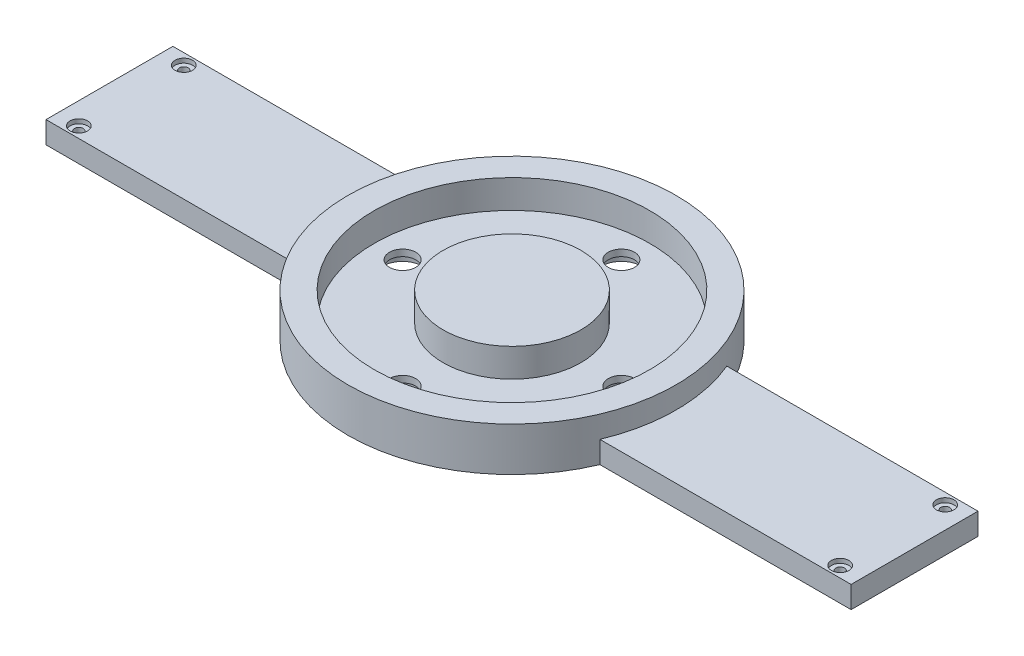
from build123d import *

# Parameters (mm, degrees)
SKETCH1_R             = 37.5
BOSS_EXTRUDE1_DEPTH   = 10
SKETCH2_R             = 31.5
CUT_EXTRUDE1_DEPTH    = 6.5
SKETCH4_R             = 15.75
BOSS_EXTRUDE2_DEPTH   = 6.5
SKETCH5_R             = 3
CUT_EXTRUDE2_DEPTH    = 3.5
CIRPATTERN3_OUTLINE_R = 3
CIRPATTERN3_DEPTH     = 3.5
BOSS_EXTRUDE3_DEPTH   = 5
CIRPATTERN4_COUNT     = 4
SKETCH9_R             = 4.5
CUT_EXTRUDE3_DEPTH    = 2
CIRPATTERN5_COUNT     = 4
SKETCH10_R            = 1
CUT_EXTRUDE4_DEPTH    = 5
LPATTERN1_COUNT       = 2
LPATTERN1_PITCH       = 174
LPATTERN1_COUNT_DIR2  = 2
LPATTERN1_PITCH_DIR2  = 24
SKETCH11_R            = 2
CUT_EXTRUDE5_DEPTH    = 1
LPATTERN2_COUNT       = 2
LPATTERN2_PITCH       = 174
LPATTERN2_COUNT_DIR2  = 2
LPATTERN2_PITCH_DIR2  = 24


# Read off the part's stored shape, not the designer's step: CirPattern3
with BuildPart() as part:
    # Sketch1 → Boss-Extrude1 (new body)
    with BuildSketch(Plane(origin=(0, 0, 0), x_dir=(1, 0, 0), z_dir=(0, 1, 0))):
        with Locations(Location((0, 0, 0), (0, 0, 270))):
            Circle(SKETCH1_R)
    extrude(amount=BOSS_EXTRUDE1_DEPTH)

    # Sketch2 → Cut-Extrude1 (cut)
    with BuildSketch(Plane(origin=(0, 10, 0), x_dir=(1, 0, 0), z_dir=(0, 1, 0))):
        with Locations(Location((0, 0, 0), (0, 0, 270))):
            Circle(SKETCH2_R)
    extrude(amount=-CUT_EXTRUDE1_DEPTH, mode=Mode.SUBTRACT)

    # Sketch4 → Boss-Extrude2 (add)
    with BuildSketch(Plane(origin=(0, 3.5, 0), x_dir=(1, 0, 0), z_dir=(0, 1, 0))):
        with Locations(Location((0, 0, 0), (0, 0, 90))):
            Circle(SKETCH4_R)
    extrude(amount=BOSS_EXTRUDE2_DEPTH)

    # Sketch5 → Cut-Extrude2 (cut)
    with BuildSketch(Plane.XZ):
        with Locations(Location((0, 25, 0), (0, 0, 270))):
            Circle(SKETCH5_R)
    extrude(amount=-CUT_EXTRUDE2_DEPTH, mode=Mode.SUBTRACT)

    # CirPattern3 outline → CirPattern3 (cut)
    with BuildSketch(Plane(origin=(0, 0, 0), x_dir=(1, 0, 0), z_dir=(0, 1, 0))):
        with Locations((-25, 0)):
            Circle(CIRPATTERN3_OUTLINE_R)
        with Locations((0, 25)):
            Circle(CIRPATTERN3_OUTLINE_R)
        with Locations((25, 0)):
            Circle(CIRPATTERN3_OUTLINE_R)
    extrude(amount=CIRPATTERN3_DEPTH, mode=Mode.SUBTRACT)

    # Sketch7 → Boss-Extrude3 (add)
    with BuildSketch(Plane.XZ):
        with BuildLine():
            Line((34.583232932, 14.5), (92.000000002, 14.5))
            Line((92.000000002, 14.5), (92.000000002, -14.5))
            Line((92.000000002, -14.5), (34.583232932, -14.5))
            ThreePointArc((34.583232932, -14.5), (37.5, 0), (34.583232932, 14.5))
        make_face()
    boss_extrude3 = extrude(amount=-BOSS_EXTRUDE3_DEPTH)

    # CirPattern4: Boss-Extrude3 ×4 about axis, 2 skipped
    cirpattern4_axis = Axis((0, 0, 0), (0, 1, 0))
    add([boss_extrude3.rotate(cirpattern4_axis, i * 360 / CIRPATTERN4_COUNT) for i in range(1, CIRPATTERN4_COUNT) if i not in (1, 3)])

    # Sketch9 → Cut-Extrude3 (cut)
    with BuildSketch(Plane.XZ):
        with Locations(Location((25, 0, 0), (0, 0, 270))):
            Circle(SKETCH9_R)
    cut_extrude3 = extrude(amount=-CUT_EXTRUDE3_DEPTH, mode=Mode.SUBTRACT)

    # CirPattern5: Cut-Extrude3 ×4 about axis
    cirpattern5_axis = Axis((0, 0, 0), (0, 1, 0))
    for i in range(1, CIRPATTERN5_COUNT):
        add(cut_extrude3.rotate(cirpattern5_axis, i * 360 / CIRPATTERN5_COUNT), mode=Mode.SUBTRACT)

    # Sketch10 → Cut-Extrude4 (cut)
    with BuildSketch(Plane(origin=(0, 0, 0), x_dir=(-1, 0, 0), z_dir=(0, -1, 0))):
        with Locations(Location((-87, -12, 0), (0, 0, 90))):
            Circle(SKETCH10_R)
    cut_extrude4 = extrude(amount=-CUT_EXTRUDE4_DEPTH, mode=Mode.SUBTRACT)

    # LPattern1: Cut-Extrude4 2 × 2
    with Locations(*[(-i * LPATTERN1_PITCH, 0, -j * LPATTERN1_PITCH_DIR2) for i in range(LPATTERN1_COUNT) for j in range(LPATTERN1_COUNT_DIR2) if (i, j) != (0, 0)]):
        add(cut_extrude4, mode=Mode.SUBTRACT)

    # Sketch11 → Cut-Extrude5 (cut)
    with BuildSketch(Plane(origin=(0, 5, 0), x_dir=(1, 0, 0), z_dir=(0, 1, 0))):
        with Locations(Location((87, -12, 0), (0, 0, 270))):
            Circle(SKETCH11_R)
    cut_extrude5 = extrude(amount=-CUT_EXTRUDE5_DEPTH, mode=Mode.SUBTRACT)

    # LPattern2: Cut-Extrude5 2 × 2
    with Locations(*[(-i * LPATTERN2_PITCH, 0, -j * LPATTERN2_PITCH_DIR2) for i in range(LPATTERN2_COUNT) for j in range(LPATTERN2_COUNT_DIR2) if (i, j) != (0, 0)]):
        add(cut_extrude5, mode=Mode.SUBTRACT)


solid = part.part
